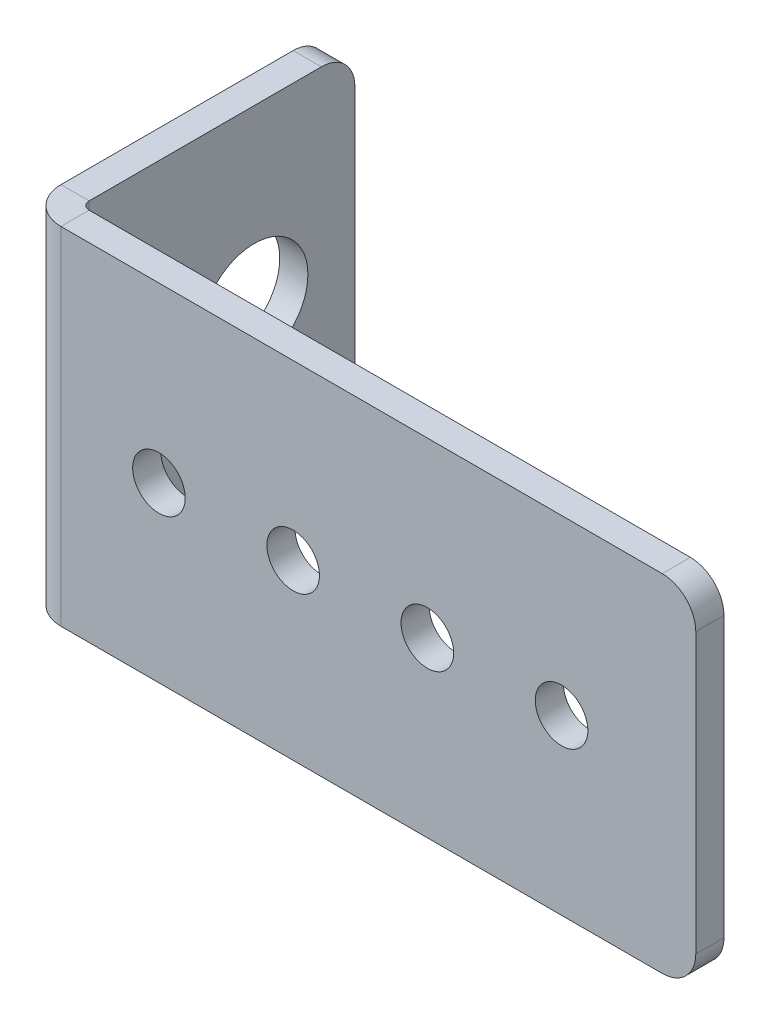
from build123d import *

# Parameters (mm, degrees)
BASE_FLANGE1_DEPTH = 32.766
SKETCH6_R          = 2.4892
CUT_EXTRUDE1_DEPTH = 77.00713927
SKETCH7_R          = 5.08
CUT_EXTRUDE2_DEPTH = 75.771620753
FILLET1_R          = 3.175


# Read off the part's stored shape, not the designer's step: Base-Flange1
with BuildPart() as part:
    # Base-Flange1 outline → Base-Flange1 (new body)
    with BuildSketch(Plane(origin=(0, 0, 0), x_dir=(1, 0, 0), z_dir=(0, 1, 0))):
        with BuildLine():
            Line((3.429, 0), (63.5, 0))
            Line((63.5, 0), (63.5, 2.667))
            Line((63.5, 2.667), (3.429, 2.667))
            ThreePointArc((3.429, 2.667), (2.890184633, 2.890184633), (2.667, 3.429))
            Line((2.667, 3.429), (2.667, 28.575))
            Line((2.667, 28.575), (0, 28.575))
            Line((0, 28.575), (0, 3.429))
            ThreePointArc((0, 3.429), (1.004330847, 1.004330847), (3.429, 0))
        make_face()
    extrude(amount=BASE_FLANGE1_DEPTH)

    # Sketch6 → Cut-Extrude1 (cut, through all)
    with BuildSketch(Plane(origin=(0, 0, -2.667), x_dir=(-1, 0, 0), z_dir=(0, 0, -1))):
        with Locations((-50.8, 16.383)):
            Circle(SKETCH6_R)
        with Locations((-38.1, 16.383)):
            Circle(SKETCH6_R)
        with Locations((-25.4, 16.383)):
            Circle(SKETCH6_R)
        with Locations((-12.7, 16.383)):
            Circle(SKETCH6_R)
    extrude(amount=-CUT_EXTRUDE1_DEPTH, mode=Mode.SUBTRACT)

    # Sketch7 → Cut-Extrude2 (cut, through all)
    with BuildSketch(Plane(origin=(2.667, 0, 0), x_dir=(0, 0, -1), z_dir=(1, 0, 0))):
        with Locations((19.05, 16.383)):
            Circle(SKETCH7_R)
    extrude(amount=-CUT_EXTRUDE2_DEPTH, mode=Mode.SUBTRACT)

    # Fillet1
    fillet1_edges = [part.edges().sort_by_distance(p)[0] for p in [
        (1.3335, 32.766, -28.575),
        (1.3335, 0, -28.575),
        (63.5, 32.766, -1.3335),
        (63.5, 0, -1.3335),
    ]]
    fillet(fillet1_edges, radius=FILLET1_R)


solid = part.part
